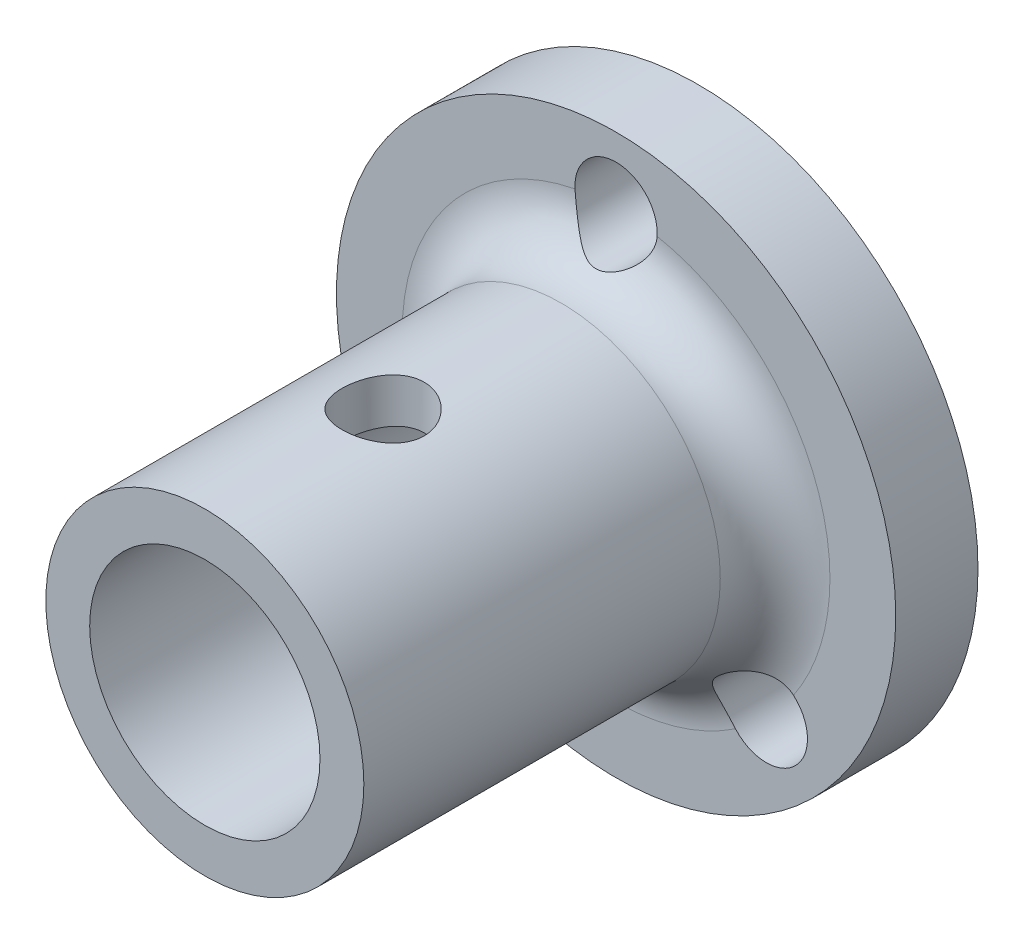
from build123d import *

# Parameters (mm, degrees)
SKETCH_1_R               = 10.2
SKETCH_1_R_2             = 4.2
SKETCH_1_R_3             = 1.5
EXTRUDE_1_DEPTH          = 1.5
SKETCH_2_R               = 5.8
SKETCH_2_R_2             = 4.2
EXTRUDE_2_DEPTH          = 15
FILLET_1_R               = 2
CUT_EXTRUDE_1_DEPTH      = 22.916432191
CUT_EXTRUDE_1_DEPTH_BACK = 22.916432191
SKETCH_3_R               = 1.5


with BuildPart() as part:
    # Эскиз1 → Бобышка-Вытянуть1 (new, symmetric)
    with BuildSketch(Plane.XY):
        Circle(SKETCH_1_R)
        Circle(SKETCH_1_R_2, mode=Mode.SUBTRACT)
        with Locations((0, 7.75)):
            Circle(SKETCH_1_R_3, mode=Mode.SUBTRACT)
        with Locations((-5.480077554, -5.480077554)):
            Circle(SKETCH_1_R_3, mode=Mode.SUBTRACT)
        with Locations(Location((5.480077554, -5.480077554, 0), (0, 0, 180))):
            Circle(SKETCH_1_R_3, mode=Mode.SUBTRACT)
    extrude(amount=EXTRUDE_1_DEPTH, both=True)

    # Эскиз2 → Бобышка-Вытянуть2 (add)
    with BuildSketch(Plane.XY.offset(1.5)):
        Circle(SKETCH_2_R)
        Circle(SKETCH_2_R_2, mode=Mode.SUBTRACT)
    extrude(amount=EXTRUDE_2_DEPTH)

    # Скругление1
    # the kernel refuses this fillet: 2 mm, written as the material it adds along each edge
    with BuildSketch(Plane(origin=(0, 0, 1.5), x_dir=(1, 0, 0), z_dir=(0, -1, 0))) as fillet_1_piece_1_section:
        with BuildLine():
            CenterArc((5.8 + FILLET_1_R, FILLET_1_R), FILLET_1_R, 180, 90)
            Line((5.8, FILLET_1_R), (5.8, 0))
            Line((5.8, 0), (5.8 + FILLET_1_R, 0))
        make_face()
    fillet_1_piece_1 = revolve(axis=Axis((0, 0, 1.5), (0, 0, 1)), mode=Mode.PRIVATE)
    fillet_1_piece_1 = fillet_1_piece_1 - Plane(origin=(-5.480077554, -5.480077554, 2.062024649), x_dir=(1, 0, 0), z_dir=(0, 0, -1)) * Cylinder(1.5, 32, mode=Mode.PRIVATE)
    fillet_1_piece_1 = fillet_1_piece_1 - Plane(origin=(5.480077554, -5.480077554, 2.062024649), x_dir=(-1, 0, 0), z_dir=(0, 0, -1)) * Cylinder(1.5, 32, mode=Mode.PRIVATE)
    fillet_1_piece_1 = fillet_1_piece_1 - Plane(origin=(0, 7.75, 2.062024649), x_dir=(1, 0, 0), z_dir=(0, 0, -1)) * Cylinder(1.5, 32, mode=Mode.PRIVATE)
    add(fillet_1_piece_1)

    # Эскиз3 → Вырез-Вытянуть1 (cut, two sides: drawn at the far end of the back side and taken through both)
    with BuildSketch(Plane(origin=(0, 0, 0), x_dir=(1, 0, 0), z_dir=(0, 1, 0)).offset(-CUT_EXTRUDE_1_DEPTH_BACK)):
        with Locations(Location((0, -10, 0), (0, 0, 270))):
            Circle(SKETCH_3_R)
    extrude(amount=CUT_EXTRUDE_1_DEPTH + CUT_EXTRUDE_1_DEPTH_BACK, mode=Mode.SUBTRACT)


solid = part.part
